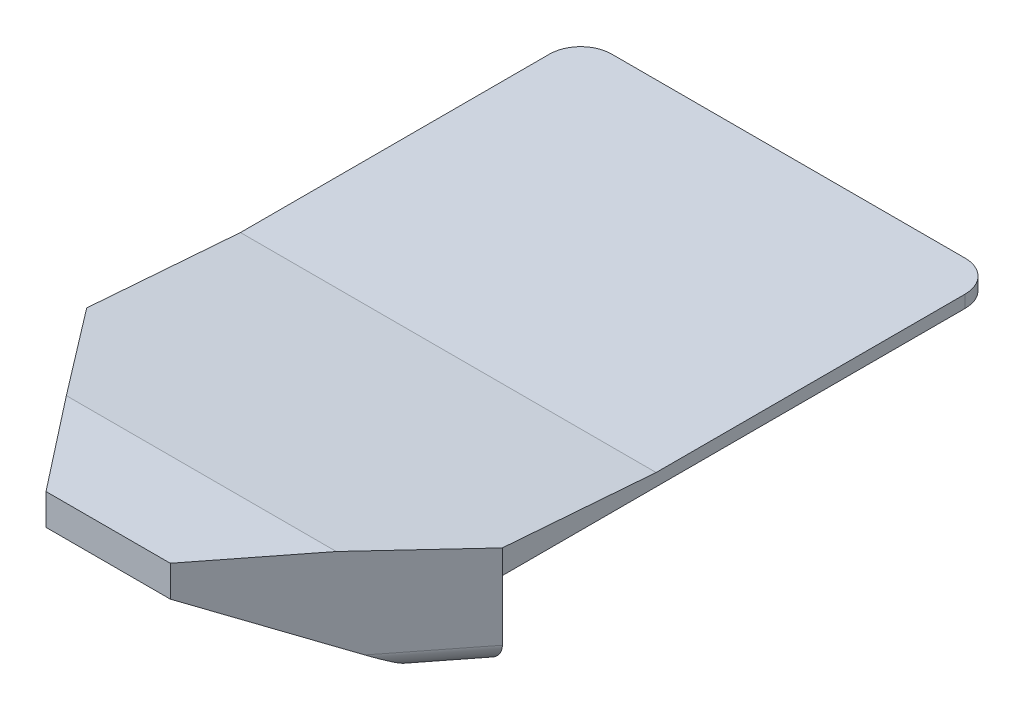
from build123d import *

# Parameters (mm, degrees)
BOSS_EXTRUDE1_DEPTH     = 7.7
SKETCH2_W               = 7
SKETCH2_H               = 3.1
CUT_EXTRUDE1_DEPTH      = 79.027559234
FILLET1_R               = 10
BOSS_EXTRUDE2_DEPTH     = 2
BOSS_EXTRUDE3_DEPTH     = 33.45
BOSS_EXTRUDE4_REACH     = 112.929
CUT_EXTRUDE2_DEPTH      = 111.928772192
CUT_EXTRUDE2_DEPTH_BACK = 111.928772192
CUT_EXTRUDE3_DEPTH      = 10
FILLET3_R               = 1
FILLET4_R               = 5
FILLET5_R               = 3


with BuildPart() as part:
    # Sketch1 → Boss-Extrude1 (new body)
    with BuildSketch(Plane(origin=(0, 0, 0), x_dir=(1, 0, 0), z_dir=(0, 1, 0))):
        Polygon((0, 0), (-16.35, 0), (-16.35, -9.85), (-2.6, -9.85), (-2.6, -33), (-20.1, -33), (-20.1, -75), (0, -75), align=None)
    extrude(amount=BOSS_EXTRUDE1_DEPTH)

    # Sketch2 → Cut-Extrude1 (cut, through all)
    with BuildSketch(Plane.XY.offset(75)):
        with Locations((-16.6, 3.55)):
            Rectangle(SKETCH2_W, SKETCH2_H)
    extrude(amount=-CUT_EXTRUDE1_DEPTH, mode=Mode.SUBTRACT)

    # Fillet1
    fillet1_edges = [part.edges().sort_by_distance(p)[0] for p in [
        (-2.6, 3.85, 33),
    ]]
    fillet(fillet1_edges, radius=FILLET1_R)

    # Sketch3 → Boss-Extrude2 (add)
    with BuildSketch(Plane(origin=(0, 7.7, 0), x_dir=(1, 0, 0), z_dir=(0, 1, 0))):
        Polygon((0, 4.5), (-33.45, 4.5), (-33.45, -75), (-10, -105), (0, -105), align=None)
    extrude(amount=BOSS_EXTRUDE2_DEPTH)

    # Sketch4 → Boss-Extrude3 (add)
    with BuildSketch(Plane(origin=(0, 0, 0), x_dir=(0, 0, -1), z_dir=(1, 0, 0))):
        Polygon((-105, 9.7), (-105, 12.7), (-90, 12.7), (-50.25, 9.7), align=None)
    extrude(amount=-BOSS_EXTRUDE3_DEPTH)

    # Boss-Extrude4: up to this face of the body (flat: up to its plane)
    boss_extrude4_end = Plane(part.part.faces().sort_by_distance((0, 5.848980441, 46.191947566))[0])
    # Sketch5 → Boss-Extrude4 (add, up to the picked face)
    with BuildSketch(Plane.ZY.offset(33.45), mode=Mode.PRIVATE) as boss_extrude4_sk1:
        Polygon((75, 7.7), (75, -5), (82, -5), (105, 7.7), align=None)
    boss_extrude4_tool1 = split(extrude(boss_extrude4_sk1.sketch, amount=-BOSS_EXTRUDE4_REACH, mode=Mode.PRIVATE), bisect_by=boss_extrude4_end, keep=Keep.BOTH, mode=Mode.PRIVATE)
    add(boss_extrude4_tool1.solids().sort_by(Axis((-33.45, 2.665766, 85.441441), (1, 0, 0)))[0])

    # Sketch6 → Cut-Extrude2 (cut, two sides: drawn at the far end of the back side and taken through both)
    with BuildSketch(Plane(origin=(0, 7.7, 0), x_dir=(1, 0, 0), z_dir=(0, 1, 0)).offset(-CUT_EXTRUDE2_DEPTH_BACK)):
        Polygon((-33.45, -75), (-10, -105), (-33.45, -105), align=None)
    extrude(amount=CUT_EXTRUDE2_DEPTH + CUT_EXTRUDE2_DEPTH_BACK, mode=Mode.SUBTRACT)

    # Sketch7 → Cut-Extrude3 (cut)
    with BuildSketch(Plane(origin=(0, 0, 0), x_dir=(0, 0, -1), z_dir=(1, 0, 0))):
        Polygon((-75, 0), (-85, 0), (-80, -5), (-75, -5), align=None)
    extrude(amount=-CUT_EXTRUDE3_DEPTH, mode=Mode.SUBTRACT)

    # Fillet3
    # the kernel refuses this fillet: 1 mm, written as the material it takes off along each edge
    with BuildSketch(Plane(origin=(5.810983209, -5, 80), x_dir=(0, 0, 1), z_dir=(-1, 0, 0))) as fillet3_piece_1:
        with BuildLine():
            CenterArc((2.350701034, 0.936487472), FILLET3_R, 135, 114.469800521)
            Line((1.643594253, 1.643594253), (1.629452117, 1.657736389))
            Line((1.629452117, 1.657736389), (-0.014142136, 0.014142136))
            Line((-0.014142136, 0.014142136), (0, -0.02))
            ThreePointArc((0, -0.02), (1, -0.02), (1.992985979, -0.018729749))
            Line((1.992985979, -0.018729749), (2, 0))
        make_face()
    extrude(amount=15.810983209, mode=Mode.SUBTRACT)
    with BuildSketch(Plane(origin=(-10, -5, 82.5), x_dir=(-1, 0, 0), z_dir=(0, 0, -1))) as fillet3_piece_2_section:
        with BuildLine():
            CenterArc((FILLET3_R, FILLET3_R), FILLET3_R, 180, 90)
            Line((0, FILLET3_R), (-FILLET3_R * 0.02, FILLET3_R))
            Line((-FILLET3_R * 0.02, FILLET3_R), (-FILLET3_R * 0.02, -FILLET3_R * 0.02))
            Line((-FILLET3_R * 0.02, -FILLET3_R * 0.02), (FILLET3_R, -FILLET3_R * 0.02))
            Line((FILLET3_R, -FILLET3_R * 0.02), (FILLET3_R, 0))
        make_face()
    fillet3_piece_2 = extrude(amount=10, mode=Mode.PRIVATE)
    fillet3_piece_2 = split(fillet3_piece_2, bisect_by=Plane(origin=(-10.222841489, -6.700692184, 78.299307816), z_dir=(0, 0.7071067811865466, -0.7071067811865485)), keep=Keep.TOP, mode=Mode.PRIVATE)
    add(fillet3_piece_2, mode=Mode.SUBTRACT)
    with BuildSketch(Plane(origin=(5.810983209, -5, 80), x_dir=(0, 0, 1), z_dir=(-1, 0, 0))) as fillet3_piece_3a_section:
        with BuildLine():
            CenterArc((2.350701034, 0.936487472), FILLET3_R, 135, 114.469800521)
            Line((1.643594253, 1.643594253), (1.629452117, 1.657736389))
            Line((1.629452117, 1.657736389), (-0.014142136, 0.014142136))
            Line((-0.014142136, 0.014142136), (0, -0.02))
            ThreePointArc((0, -0.02), (1, -0.02), (1.992985979, -0.018729749))
            Line((1.992985979, -0.018729749), (2, 0))
        make_face()
    fillet3_piece_3a = extrude(amount=21.621966417, mode=Mode.PRIVATE)
    fillet3_piece_3a = split(fillet3_piece_3a, bisect_by=Plane(origin=(-10, -4.567151235, 80.996776665), z_dir=(-1, 0, 0)), keep=Keep.TOP, mode=Mode.PRIVATE)
    with BuildSketch(Plane(origin=(-10, -5, 82.5), x_dir=(-1, 0, 0), z_dir=(0, 0, -1))) as fillet3_piece_3b_section:
        with BuildLine():
            CenterArc((FILLET3_R, FILLET3_R), FILLET3_R, 180, 90)
            Line((0, FILLET3_R), (-FILLET3_R * 0.02, FILLET3_R))
            Line((-FILLET3_R * 0.02, FILLET3_R), (-FILLET3_R * 0.02, -FILLET3_R * 0.02))
            Line((-FILLET3_R * 0.02, -FILLET3_R * 0.02), (FILLET3_R, -FILLET3_R * 0.02))
            Line((FILLET3_R, -FILLET3_R * 0.02), (FILLET3_R, 0))
        make_face()
    fillet3_piece_3b = extrude(amount=10, mode=Mode.PRIVATE)
    fillet3_piece_3b = split(fillet3_piece_3b, bisect_by=Plane(origin=(-10.238471404, -4.220535034, 80.779464966), z_dir=(0, -0.7071067811865466, 0.7071067811865485)), keep=Keep.TOP, mode=Mode.PRIVATE)
    fillet3_piece_3 = fillet3_piece_3a & fillet3_piece_3b
    add(fillet3_piece_3, mode=Mode.SUBTRACT)

    # Fillet4
    fillet4_edges = [part.edges().sort_by_distance(p)[0] for p in [
        (-33.45, 8.7, -4.5),
    ]]
    fillet(fillet4_edges, radius=FILLET4_R)

    # Mirror1: part across plane


with BuildPart() as part_1:
    add(part.part)
    add(part.part.mirror(Plane(origin=(0, 7.7, 75), x_dir=(0, 0, 1), z_dir=(-1, 0, 0))))

    # Fillet5
    # the kernel refuses this fillet: 3 mm, written as the material it takes off along each edge
    with BuildSketch(Plane(origin=(-38.068859068, -5, 69.091011854), x_dir=(0.7878650861711843, 0, -0.6158478756904764), z_dir=(0.6158478756904763, 0, 0.7878650861711843))) as fillet5_piece_1:
        with BuildLine():
            CenterArc((FILLET5_R, FILLET5_R), FILLET5_R, 180, 90)
            Line((0, FILLET5_R), (0, 0))
            Line((0, 0), (FILLET5_R, 0))
        make_face()
    extrude(amount=23.884769896, mode=Mode.SUBTRACT)
    with BuildSketch(Plane(origin=(38.068859068, -5, 69.091011854), x_dir=(-0.7878650861711843, 0, -0.6158478756904764), z_dir=(-0.6158478756904763, 0, 0.7878650861711843))) as fillet5_piece_2:
        with BuildLine():
            CenterArc((FILLET5_R, -FILLET5_R), FILLET5_R, 90, 90)
            Line((0, -FILLET5_R), (0, 0))
            Line((0, 0), (FILLET5_R, 0))
        make_face()
    extrude(amount=23.884769896, mode=Mode.SUBTRACT)


solid = part_1.part
